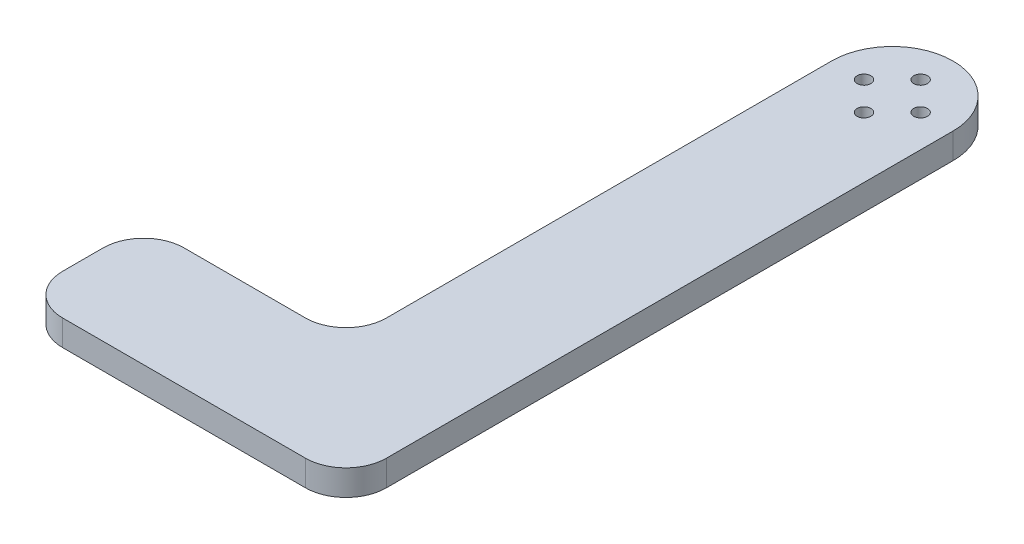
from build123d import *

# Parameters (mm, degrees)
BOSS_EXTRUDE1_DEPTH  = 6.35
M3_CLEARANCE_HOLE1_D = 3.4
CIRPATTERN1_COUNT    = 4
FILLET1_R            = 10


with BuildPart() as part:
    # Sketch2 → Boss-Extrude1 (new body)
    with BuildSketch(Plane(origin=(0, 0, 0), x_dir=(1, 0, 0), z_dir=(0, 1, 0))):
        with BuildLine():
            Line((15, -150), (15, 0))
            ThreePointArc((15, 0), (0, 15), (-15, 0))
            Line((-15, 0), (-15, -120))
            Line((-15, -120), (-65, -120))
            Line((-65, -120), (-65, -150))
            Line((-65, -150), (15, -150))
        make_face()
    extrude(amount=BOSS_EXTRUDE1_DEPTH)

    # M3 Clearance Hole1 (through all)
    with Locations(Plane(origin=(0, 6.35, 0), x_dir=(1, 0, 0), z_dir=(0, 1, 0))):
        with Locations((0, 7)):
            m3_clearance_hole1 = Hole(M3_CLEARANCE_HOLE1_D / 2)

    # CirPattern1: M3 Clearance Hole1 ×4 about axis
    cirpattern1_axis = Axis((0, 6.35, 0), (0, -1, 0))
    for i in range(1, CIRPATTERN1_COUNT):
        add(m3_clearance_hole1.rotate(cirpattern1_axis, i * 360 / CIRPATTERN1_COUNT), mode=Mode.SUBTRACT)

    # Fillet1
    fillet1_edges = [part.edges().sort_by_distance(p)[0] for p in [
        (15, 3.175, 150),
        (-65, 3.175, 150),
        (-65, 3.175, 120),
        (-15, 3.175, 120),
    ]]
    fillet(fillet1_edges, radius=FILLET1_R)


solid = part.part
